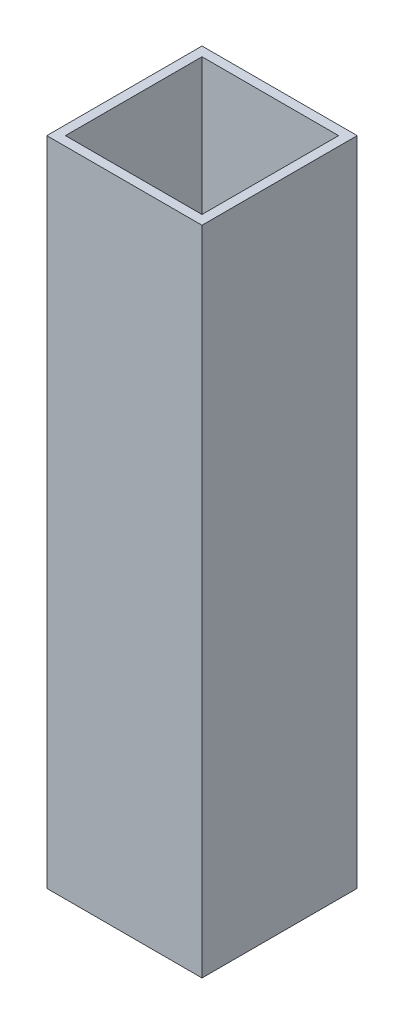
from build123d import *

# Parameters (mm, degrees)
SKETCH1_W           = 12.5
SKETCH1_H           = 12.5
SKETCH1_W_2         = 11
SKETCH1_H_2         = 11
BOSS_EXTRUDE3_DEPTH = 52.5


with BuildPart() as part:
    # Sketch1 → Boss-Extrude3 (new body)
    with BuildSketch(Plane(origin=(0, 0, 0), x_dir=(1, 0, 0), z_dir=(0, 1, 0))):
        with Locations((-20.377754415, -4.412827368)):
            Rectangle(SKETCH1_W, SKETCH1_H)
        with Locations((-20.377754415, -4.412827368)):
            Rectangle(SKETCH1_W_2, SKETCH1_H_2, mode=Mode.SUBTRACT)
    extrude(amount=BOSS_EXTRUDE3_DEPTH)


solid = part.part
